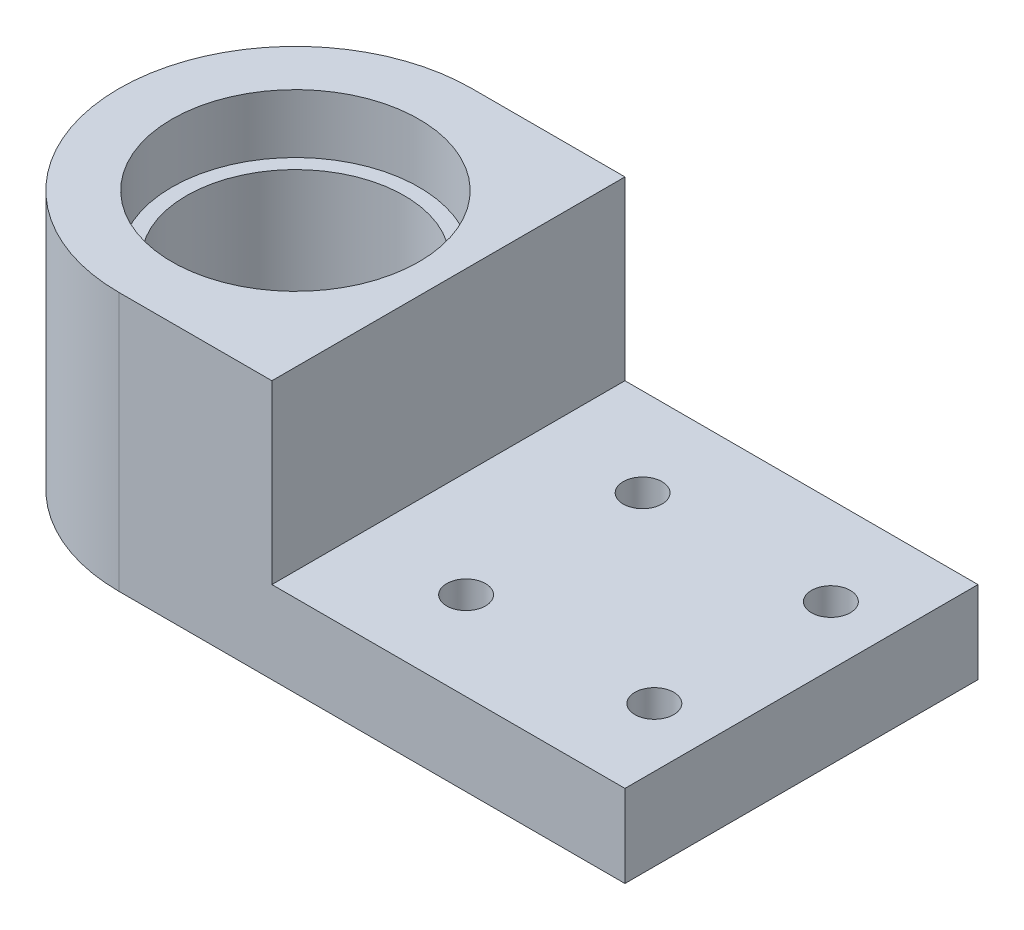
from build123d import *

# Parameters (mm, degrees)
EXTRUDE_1_DEPTH              = 60
FILLET_1_R                   = 30
SKETCH_2_R                   = 21
CUT_EXTRUDE_1_DEPTH          = 10
CUT_EXTRUDE_2_DEPTH          = 135.951843263
CUT_EXTRUDE_2_DEPTH_BACK     = 135.951843263
SKETCH_3_R                   = 18.5
HOLE_WIZARD_M6_1_D           = 6.6
HOLE_WIZARD_M6_1_CBORE_D     = 11
HOLE_WIZARD_M6_1_CBORE_DEPTH = 6.8


with BuildPart() as part:
    # 草图1 → 凸台-拉伸1 (new body)
    with BuildSketch(Plane.XY):
        Polygon((0, 0), (-116, 0), (-116, 44), (-60, 44), (-60, 14), (0, 14), align=None)
    extrude(amount=EXTRUDE_1_DEPTH)

    # 圆角1
    fillet_1_edges = [part.edges().sort_by_distance(p)[0] for p in [
        (-116, 22, 60),
        (-116, 22, 0),
    ]]
    fillet(fillet_1_edges, radius=FILLET_1_R - 0.0001)  # a hair under: the kernel refuses the full size

    # 草图2 → 切除-拉伸1 (cut)
    with BuildSketch(Plane(origin=(0, 44, 0), x_dir=(1, 0, 0), z_dir=(0, 1, 0))):
        with Locations(Location((-86, -30, 0), (0, 0, 180))):
            Circle(SKETCH_2_R)
    extrude(amount=-CUT_EXTRUDE_1_DEPTH, mode=Mode.SUBTRACT)

    # 草图3 → 切除-拉伸2 (cut, two sides: drawn at the far end of the back side and taken through both)
    with BuildSketch(Plane(origin=(0, 34, 0), x_dir=(1, 0, 0), z_dir=(0, 1, 0)).offset(-CUT_EXTRUDE_2_DEPTH_BACK)):
        with Locations(Location((-86, -30, 0), (0, 0, 180))):
            Circle(SKETCH_3_R)
    extrude(amount=CUT_EXTRUDE_2_DEPTH + CUT_EXTRUDE_2_DEPTH_BACK, mode=Mode.SUBTRACT)

    # M6 六角圆柱头螺钉的柱形沉头孔1 (through all)
    with Locations(Plane.XZ):
        with Locations((-10, 45), (-42, 15), (-42, 45), (-10, 15)):
            CounterBoreHole(HOLE_WIZARD_M6_1_D / 2, HOLE_WIZARD_M6_1_CBORE_D / 2, HOLE_WIZARD_M6_1_CBORE_DEPTH)


solid = part.part
